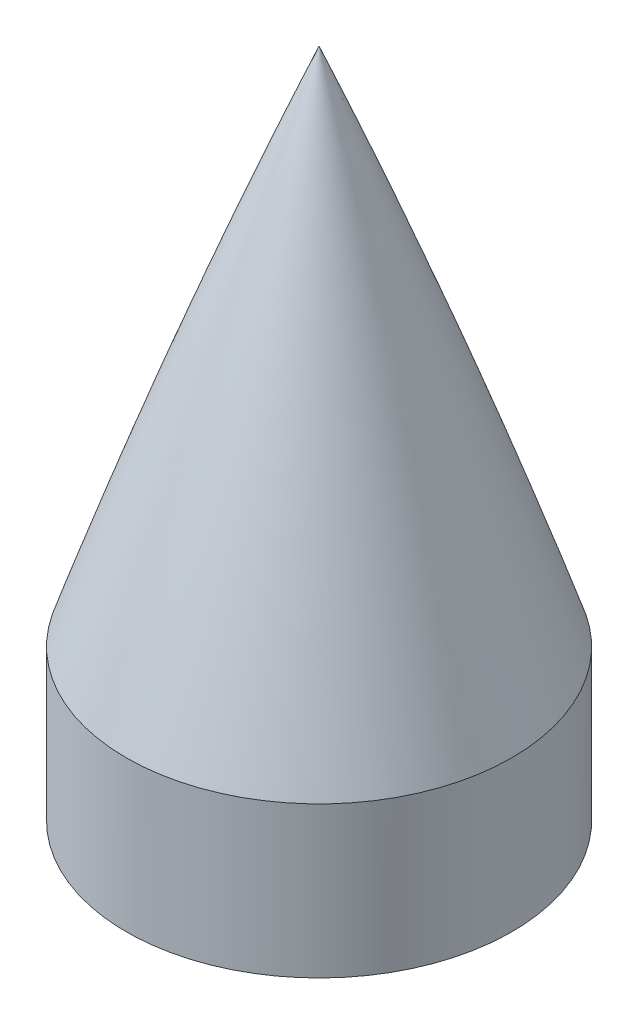
from build123d import *

# Parameters (mm, degrees)
BOSS_EXTRUDE1_REACH = 566.43
SKETCH5_R           = 78.35
SKETCH6_R           = 25.5698544
SKETCH6_R_2         = 22.409351833
BOSS_EXTRUDE2_DEPTH = 20


# Read off the part's stored shape, not the designer's step: Shell1
with BuildPart() as part:
    # Sketch1 → Revolve3 (revolve)
    with BuildSketch(Plane.XY, mode=Mode.PRIVATE) as revolve3_sk:
        with BuildLine():
            Line((0, 400), (0, 402.756656622))
            ThreePointArc((0, 402.756656622), (60.363605816, 205.385909299), (80.75, 0))
            Line((80.75, 0), (80.75, -150))
            Line((80.75, -150), (78.35, -150))
            Line((78.35, -150), (78.35, 0))
            ThreePointArc((78.35, 0), (58.574924408, 202.078213736), (0, 396.489212171))
            Line((0, 396.489212171), (0, 400))
        make_face()
    revolve(revolve3_sk.sketch.rotate(Axis((0, 400, 0), (0, 1, 0)), 270), axis=Axis((0, 400, 0), (0, 1, 0)))


with BuildPart() as body_2:

    # Sketch5 → Boss-Extrude1 (new, up to next)
    with BuildSketch(Plane.XZ.offset(150), mode=Mode.PRIVATE) as boss_extrude1_sk1:
        with Locations(Location((0, 0, 0), (0, 0, 270))):
            Circle(SKETCH5_R)
    boss_extrude1_tool1 = extrude(boss_extrude1_sk1.sketch, amount=-BOSS_EXTRUDE1_REACH, mode=Mode.PRIVATE) - part.part
    add(boss_extrude1_tool1.solids().sort_by_distance((0, -150, 0))[0])


with BuildPart() as body_2_2:
    # Split1: the piece on the far side of the plane
    add(body_2.part)
    split(bisect_by=Plane.ZX.offset(327.489212171), keep=Keep.BOTTOM)


with BuildPart() as body_2_1:
    add(body_2.part)

    # Split1
    split(bisect_by=Plane.ZX.offset(327.489212171), keep=Keep.TOP)

    # Shell1 outline → Shell1 (revolve, cut)
    with BuildSketch(Plane.XY):
        with BuildLine():
            Line((0, 327.489212071), (22.409351833, 327.489212171))
            add(Edge.make_bspline(
                [(22.409351833, 327.489212171), (12.15992843, 358.362079044), (0, 388.533600877)],
                knots=[0.320539327, 0.320539327, 0.320539327, 0.383112862, 0.383112862, 0.383112862], degree=2, weights=[1, 0.999510609, 1]))
            Line((0, 388.533600877), (0, 327.489212071))
        make_face()
    revolve(axis=Axis((0, 0, 0), (0, 1, 0)), mode=Mode.SUBTRACT)

    # Sketch6 → Boss-Extrude2 (add)
    with BuildSketch(Plane.XZ.offset(-327.489212171)):
        with Locations(Location((0, 0, 0), (0, 0, 270))):
            Circle(SKETCH6_R)
        with Locations(Location((0, 0, 0), (0, 0, 90))):
            Circle(SKETCH6_R_2, mode=Mode.SUBTRACT)
    extrude(amount=BOSS_EXTRUDE2_DEPTH)


solid = body_2_1.part
